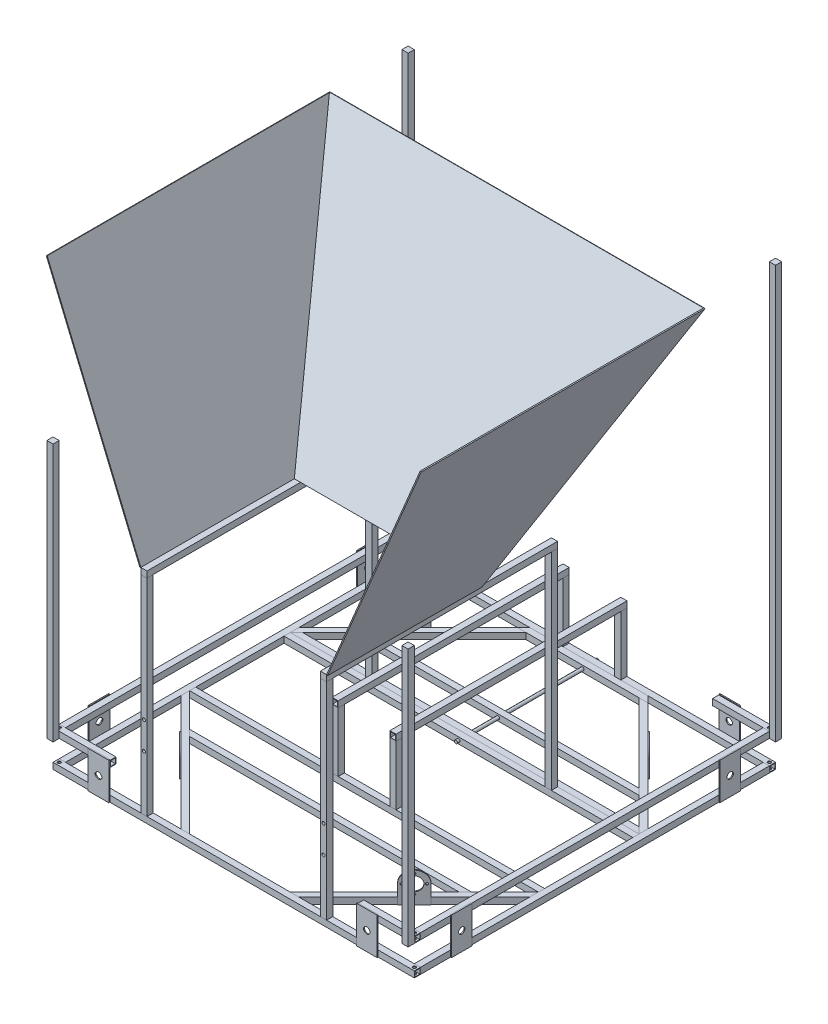
from build123d import *

# Parameters (mm, degrees)
BOSS_EXTRUDE1_DEPTH       = 12
BOSS_EXTRUDE1_2_DEPTH     = 12
SKETCH1_W                 = 676
SKETCH1_H                 = 12
BOSS_EXTRUDE1_3_DEPTH     = 12
BOSS_EXTRUDE1_4_DEPTH     = 12
BOSS_EXTRUDE1_5_DEPTH     = 12
BOSS_EXTRUDE1_6_DEPTH     = 12
SHELL1_T                  = -1.2
SHELL2_T                  = -1.2
SHELL3_T                  = -1.2
SHELL4_T                  = -1.2
SHELL5_T                  = -1.2
SHELL6_T                  = -1.2
BOSS_EXTRUDE2_DEPTH       = 12
BOSS_EXTRUDE2_2_DEPTH     = 12
BOSS_EXTRUDE2_3_DEPTH     = 12
BOSS_EXTRUDE2_4_DEPTH     = 12
SHELL7_T                  = -1.2
SHELL8_T                  = -1.2
SHELL9_T                  = -1.2
SHELL10_T                 = -1.2
BOSS_EXTRUDE3_DEPTH       = 12
BOSS_EXTRUDE3_2_DEPTH     = 12
BOSS_EXTRUDE3_3_DEPTH     = 12
BOSS_EXTRUDE3_4_DEPTH     = 12
SHELL11_T                 = -1.2
SHELL12_T                 = -1.2
SHELL13_T                 = -1.2
SHELL14_T                 = -1.2
BOSS_EXTRUDE4_START       = 5
SKETCH2_R                 = 3
BOSS_EXTRUDE4_DEPTH       = 274.422222789
LPATTERN1_COUNT           = 2
LPATTERN1_PITCH           = 58
SKETCH3_R                 = 2.1
SKETCH3_R_2               = 13.25
BOSS_EXTRUDE5_DEPTH       = 2
CIRPATTERN1_COUNT         = 4
SKETCH4_R                 = 3
CUT_EXTRUDE2_DEPTH        = 504.413349048
SKETCH8_W                 = 40
SKETCH8_H                 = 12
SKETCH8_H_2               = 59.4
BOSS_EXTRUDE6_DEPTH       = 2
CIRPATTERN2_START         = -352
CIRPATTERN2_OUTLINE_W     = 40
CIRPATTERN2_OUTLINE_H     = 71.4
CIRPATTERN2_DEPTH         = 2
CIRPATTERN2_2_OUTLINE_W   = 71.4
CIRPATTERN2_2_OUTLINE_H   = 40
CIRPATTERN2_2_DEPTH       = 2
CIRPATTERN2_START_2       = 350
CIRPATTERN2_3_OUTLINE_W   = 71.4
CIRPATTERN2_3_OUTLINE_H   = 40
CIRPATTERN2_3_DEPTH       = 2
SKETCH9_W                 = 480
SKETCH9_H                 = 25.007528644
CUT_EXTRUDE4_DEPTH        = 12
SKETCH13_W                = 12
SKETCH13_H                = 12
BOSS_EXTRUDE7_DEPTH       = 400
BOSS_EXTRUDE7_2_DEPTH     = 400
SKETCH16_W                = 12
SKETCH16_H                = 12
BOSS_EXTRUDE8_DEPTH       = 500
BOSS_EXTRUDE8_2_DEPTH     = 500
SKETCH17_W                = 12
SKETCH17_H                = 12
BOSS_EXTRUDE9_DEPTH       = 800
BOSS_EXTRUDE9_2_DEPTH     = 800
SKETCH18_W                = 12
SKETCH18_H                = 12
BOSS_EXTRUDE10_DEPTH      = 400
BOSS_EXTRUDE10_2_DEPTH    = 400
SKETCH19_W                = 12
SKETCH19_H                = 12
BOSS_EXTRUDE11_DEPTH      = 447.58
BOSS_EXTRUDE11_2_DEPTH    = 447.58
SKETCH20_R                = 3
CUT_EXTRUDE5_DEPTH        = 12
EXTRUDE_THIN1_OUTLINE_W   = 12
EXTRUDE_THIN1_OUTLINE_H   = 12
EXTRUDE_THIN1_OUTLINE_W_2 = 9.6
EXTRUDE_THIN1_OUTLINE_H_2 = 9.6
EXTRUDE_THIN1_DEPTH       = 115
SKETCH22_W                = 12
SKETCH22_H                = 12
SKETCH22_W_2              = 9.6
SKETCH22_H_2              = 9.6
EXTRUDE_THIN2_DEPTH       = 447.577777211
EXTRUDE_THIN2_2_DEPTH     = 447.577777211
SKETCH23_W                = 480
SKETCH23_H                = 12
CUT_EXTRUDE6_DEPTH        = 12
BOSS_EXTRUDE12_DEPTH      = 2
BOSS_EXTRUDE13_DEPTH      = 2


# Read off the part's stored shape, not the designer's step: CirPattern2, Extrude-Thin1
with BuildPart() as part:
    # Sketch1 → Boss-Extrude1 (new body)
    with BuildSketch(Plane(origin=(0, 0, 0), x_dir=(1, 0, 0), z_dir=(0, 1, 0))):
        Polygon((-350, -350), (350, -350), (350, -338), (338, -338), (114.548339959, -338), (97.577777211, -338), (-97.577777211, -338), (-114.548339959, -338), (-338, -338), (-350, -338), align=None)
    extrude(amount=BOSS_EXTRUDE1_DEPTH)

    # Shell1
    shell1_openings = [part.faces().sort_by_distance(p)[0] for p in [
        (-350, 6, 344),
        (350, 6, 344),
    ]]
    offset(amount=SHELL1_T, openings=shell1_openings, kind=Kind.INTERSECTION)


with BuildPart() as body_2:
    # Sketch1 → Boss-Extrude1 2 (new body)
    with BuildSketch(Plane(origin=(0, 0, 0), x_dir=(1, 0, 0), z_dir=(0, 1, 0))):
        Polygon((261.286323091, -174.29145412), (273.286323091, -162.29145412), (-273.286323091, -162.29145412), (-261.286323091, -174.29145412), align=None)
    extrude(amount=BOSS_EXTRUDE1_2_DEPTH)

    # Shell2
    shell2_openings = [body_2.faces().sort_by_distance(p)[0] for p in [
        (-267.286323091, 6, 168.29145412),
        (267.286323091, 6, 168.29145412),
    ]]
    offset(amount=SHELL2_T, openings=shell2_openings, kind=Kind.INTERSECTION)


with BuildPart() as body_3:
    # Sketch1 → Boss-Extrude1 3 (new body)
    with BuildSketch(Plane(origin=(0, 0, 0), x_dir=(1, 0, 0), z_dir=(0, 1, 0))):
        with Locations((0, -91.577777211)):
            Rectangle(SKETCH1_W, SKETCH1_H)
    extrude(amount=BOSS_EXTRUDE1_3_DEPTH)

    # Shell3
    shell3_openings = [body_3.faces().sort_by_distance(p)[0] for p in [
        (338, 6, 91.577777211),
        (-338, 6, 91.577777211),
    ]]
    offset(amount=SHELL3_T, openings=shell3_openings, kind=Kind.INTERSECTION)


with BuildPart() as body_4:
    # Sketch1 → Boss-Extrude1 4 (new body)
    with BuildSketch(Plane(origin=(0, 0, 0), x_dir=(1, 0, 0), z_dir=(0, 1, 0))):
        with Locations((0, 91.577777211)):
            Rectangle(SKETCH1_W, SKETCH1_H)
    extrude(amount=BOSS_EXTRUDE1_4_DEPTH)

    # Shell4
    shell4_openings = [body_4.faces().sort_by_distance(p)[0] for p in [
        (338, 6, -91.577777211),
        (-338, 6, -91.577777211),
    ]]
    offset(amount=SHELL4_T, openings=shell4_openings, kind=Kind.INTERSECTION)


with BuildPart() as body_5:
    # Sketch1 → Boss-Extrude1 5 (new body)
    with BuildSketch(Plane(origin=(0, 0, 0), x_dir=(1, 0, 0), z_dir=(0, 1, 0))):
        Polygon((338, 338), (350, 338), (350, 350), (-350, 350), (-350, 338), (-338, 338), (-114.548339959, 338), (114.548339959, 338), align=None)
    extrude(amount=BOSS_EXTRUDE1_5_DEPTH)

    # Shell6
    shell6_openings = [body_5.faces().sort_by_distance(p)[0] for p in [
        (-350, 6, -344),
        (350, 6, -344),
    ]]
    offset(amount=SHELL6_T, openings=shell6_openings, kind=Kind.INTERSECTION)


with BuildPart() as body_6:
    # Sketch1 → Boss-Extrude1 6 (new body)
    with BuildSketch(Plane(origin=(0, 0, 0), x_dir=(1, 0, 0), z_dir=(0, 1, 0))):
        Polygon((273.286323091, 162.29145412), (261.286323091, 174.29145412), (-261.286323091, 174.29145412), (-273.286323091, 162.29145412), align=None)
    extrude(amount=BOSS_EXTRUDE1_6_DEPTH)

    # Shell5
    shell5_openings = [body_6.faces().sort_by_distance(p)[0] for p in [
        (-267.286323091, 6, -168.29145412),
        (267.286323091, 6, -168.29145412),
    ]]
    offset(amount=SHELL5_T, openings=shell5_openings, kind=Kind.INTERSECTION)


with BuildPart() as body_7:
    # Sketch1<3> → Boss-Extrude2 (new body)
    with BuildSketch(Plane(origin=(0, 0, 0), x_dir=(1, 0, 0), z_dir=(0, 1, 0))):
        Polygon((-338, -97.577777211), (-338, -114.548339959), (-114.548339959, -338), (-97.577777211, -338), (-261.286323091, -174.29145412), (-273.286323091, -162.29145412), align=None)
    extrude(amount=BOSS_EXTRUDE2_DEPTH)

    # Shell7
    shell7_openings = [body_7.faces().sort_by_distance(p)[0] for p in [
        (-338, 6, 106.063058585),
        (-106.063058585, 6, 338),
    ]]
    offset(amount=SHELL7_T, openings=shell7_openings, kind=Kind.INTERSECTION)


with BuildPart() as body_8:
    # Sketch1<3> → Boss-Extrude2 2 (new body)
    with BuildSketch(Plane(origin=(0, 0, 0), x_dir=(1, 0, 0), z_dir=(0, 1, 0))):
        Polygon((114.548339959, -338), (338, -114.548339959), (338, -97.577777211), (273.286323091, -162.29145412), (261.286323091, -174.29145412), (97.577777211, -338), align=None)
    extrude(amount=BOSS_EXTRUDE2_2_DEPTH)

    # Shell8
    shell8_openings = [body_8.faces().sort_by_distance(p)[0] for p in [
        (106.063058585, 6, 338),
        (338, 6, 106.063058585),
    ]]
    offset(amount=SHELL8_T, openings=shell8_openings, kind=Kind.INTERSECTION)


with BuildPart() as body_9:
    # Sketch1<3> → Boss-Extrude2 3 (new body)
    with BuildSketch(Plane(origin=(0, 0, 0), x_dir=(1, 0, 0), z_dir=(0, 1, 0))):
        Polygon((-126.548339959, 326), (-338, 114.548339959), (-338, 97.577777211), (-326, 109.577777211), (-273.286323091, 162.29145412), (-261.286323091, 174.29145412), (-109.577777211, 326), align=None)
    extrude(amount=BOSS_EXTRUDE2_3_DEPTH)

    # Shell10
    shell10_openings = [body_9.faces().sort_by_distance(p)[0] for p in [
        (-338, 6, -106.063058585),
        (-118.063058585, 6, -326),
    ]]
    offset(amount=SHELL10_T, openings=shell10_openings, kind=Kind.INTERSECTION)


with BuildPart() as body_10:
    # Sketch1<3> → Boss-Extrude2 4 (new body)
    with BuildSketch(Plane(origin=(0, 0, 0), x_dir=(1, 0, 0), z_dir=(0, 1, 0))):
        Polygon((338, 97.577777211), (338, 114.548339959), (126.548339959, 326), (109.577777211, 326), (261.286323091, 174.29145412), (273.286323091, 162.29145412), (326, 109.577777211), align=None)
    extrude(amount=BOSS_EXTRUDE2_4_DEPTH)

    # Shell9
    shell9_openings = [body_10.faces().sort_by_distance(p)[0] for p in [
        (338, 6, -106.063058585),
        (118.063058585, 6, -326),
    ]]
    offset(amount=SHELL9_T, openings=shell9_openings, kind=Kind.INTERSECTION)


with BuildPart() as body_11:
    # Sketch1<4> → Boss-Extrude3 (new body)
    with BuildSketch(Plane(origin=(0, 0, 0), x_dir=(1, 0, 0), z_dir=(0, 1, 0))):
        Polygon((-350, 338), (-350, -338), (-338, -338), (-338, -114.548339959), (-338, -97.577777211), (-338, -85.577777211), (-338, 85.577777211), (-338, 97.577777211), (-338, 114.548339959), (-338, 338), align=None)
    extrude(amount=BOSS_EXTRUDE3_DEPTH)

    # Shell14
    shell14_openings = [body_11.faces().sort_by_distance(p)[0] for p in [
        (-344, 6, -338),
        (-344, 6, 338),
    ]]
    offset(amount=SHELL14_T, openings=shell14_openings, kind=Kind.INTERSECTION)


with BuildPart() as body_12:
    # Sketch1<4> → Boss-Extrude3 2 (new body)
    with BuildSketch(Plane(origin=(0, 0, 0), x_dir=(1, 0, 0), z_dir=(0, 1, 0))):
        Polygon((126.548339959, 326), (114.548339959, 338), (-114.548339959, 338), (-126.548339959, 326), (-109.577777211, 326), (109.577777211, 326), align=None)
    extrude(amount=BOSS_EXTRUDE3_2_DEPTH)

    # Shell12
    shell12_openings = [body_12.faces().sort_by_distance(p)[0] for p in [
        (-120.548339959, 6, -332),
        (120.548339959, 6, -332),
    ]]
    offset(amount=SHELL12_T, openings=shell12_openings, kind=Kind.INTERSECTION)


with BuildPart() as body_13:
    # Sketch1<4> → Boss-Extrude3 3 (new body)
    with BuildSketch(Plane(origin=(0, 0, 0), x_dir=(1, 0, 0), z_dir=(0, 1, 0))):
        Polygon((338, -338), (350, -338), (350, 338), (338, 338), (338, 114.548339959), (338, 97.577777211), (338, 85.577777211), (338, -85.577777211), (338, -97.577777211), (338, -114.548339959), align=None)
    extrude(amount=BOSS_EXTRUDE3_3_DEPTH)

    # Shell13
    shell13_openings = [body_13.faces().sort_by_distance(p)[0] for p in [
        (344, 6, -338),
        (344, 6, 338),
    ]]
    offset(amount=SHELL13_T, openings=shell13_openings, kind=Kind.INTERSECTION)


with BuildPart() as body_14:
    # Sketch1<4> → Boss-Extrude3 4 (new body)
    with BuildSketch(Plane(origin=(0, 0, 0), x_dir=(1, 0, 0), z_dir=(0, 1, 0))):
        Polygon((-338, 97.577777211), (338, 97.577777211), (326, 109.577777211), (-326, 109.577777211), align=None)
    extrude(amount=BOSS_EXTRUDE3_4_DEPTH)

    # Shell11
    shell11_openings = [body_14.faces().sort_by_distance(p)[0] for p in [
        (332, 6, -103.577777211),
        (-332, 6, -103.577777211),
    ]]
    offset(amount=SHELL11_T, openings=shell11_openings, kind=Kind.INTERSECTION)


with BuildPart() as body_15:
    # Sketch2 → Boss-Extrude4 (new body)
    with BuildSketch(Plane(origin=(0, 0, -350), x_dir=(-1, 0, 0), z_dir=(0, 0, -1)).offset(BOSS_EXTRUDE4_START)):
        with Locations((0, 6)):
            Circle(SKETCH2_R)
    extrude(amount=-BOSS_EXTRUDE4_DEPTH)


with BuildPart() as lpattern1_1:
    # LPattern1: pattern copy
    add(body_11.part.moved(Location(Vector(0, 1, 0) * (1 * LPATTERN1_PITCH))))


with BuildPart() as lpattern1_2:
    # LPattern1: pattern copy
    add(body_5.part.moved(Location(Vector(0, 1, 0) * (1 * LPATTERN1_PITCH))))


with BuildPart() as lpattern1_3:
    # LPattern1: pattern copy
    add(body_13.part.moved(Location(Vector(0, 1, 0) * (1 * LPATTERN1_PITCH))))


with BuildPart() as lpattern1_4:
    # LPattern1: pattern copy
    add(part.part.moved(Location(Vector(0, 1, 0) * (1 * LPATTERN1_PITCH))))


with BuildPart() as body_20:
    # Sketch3 → Boss-Extrude5 (new body)
    with BuildSketch(Plane(origin=(226.27416998, 0, -226.27416998), x_dir=(-0.7071067811865475, 0, -0.7071067811865477), z_dir=(0.7071067811865477, 0, -0.7071067811865475))):
        with BuildLine():
            Line((-23, 35.7), (-23, 0))
            Line((-23, 0), (23, 0))
            Line((23, 0), (23, 35.7))
            ThreePointArc((23, 35.7), (0, 58.7), (-23, 35.7))
        make_face()
        with Locations((17.5, 35.7)):
            Circle(SKETCH3_R, mode=Mode.SUBTRACT)
        with Locations((0, 18.2)):
            Circle(SKETCH3_R, mode=Mode.SUBTRACT)
        with Locations((0, 35.7)):
            Circle(SKETCH3_R_2, mode=Mode.SUBTRACT)
        with Locations((-17.5, 35.7)):
            Circle(SKETCH3_R, mode=Mode.SUBTRACT)
        with Locations((0, 53.2)):
            Circle(SKETCH3_R, mode=Mode.SUBTRACT)
    extrude(amount=BOSS_EXTRUDE5_DEPTH)


with BuildPart() as cirpattern1_1:
    # CirPattern1: pattern copy
    add(body_20.part.rotate(Axis((0, 0, 0), (0, 1, 0)), 1 * 360 / CIRPATTERN1_COUNT))


with BuildPart() as cirpattern1_2:
    # CirPattern1: pattern copy
    add(body_20.part.rotate(Axis((0, 0, 0), (0, 1, 0)), 2 * 360 / CIRPATTERN1_COUNT))


with BuildPart() as cirpattern1_3:
    # CirPattern1: pattern copy
    add(body_20.part.rotate(Axis((0, 0, 0), (0, 1, 0)), 3 * 360 / CIRPATTERN1_COUNT))


with BuildPart() as cut_extrude2_tool:
    # Sketch4 → Cut-Extrude2 (new, through all)
    with BuildSketch(Plane(origin=(0, 0, 0), x_dir=(1, 0, 0), z_dir=(0, 1, 0))):
        with Locations(Location((-344, 344, 0), (0, 0, 270))):
            Circle(SKETCH4_R)
        with Locations(Location((344, 344, 0), (0, 0, 270))):
            Circle(SKETCH4_R)
        with Locations(Location((344, -344, 0), (0, 0, 270))):
            Circle(SKETCH4_R)
        with Locations(Location((-344, -344, 0), (0, 0, 270))):
            Circle(SKETCH4_R)
    extrude(amount=CUT_EXTRUDE2_DEPTH)


with BuildPart() as part_1:
    add(part.part)

    # Cut-Extrude2: cut by cut_extrude2_tool
    add(cut_extrude2_tool.part, mode=Mode.SUBTRACT)


with BuildPart() as body_5_1:
    add(body_5.part)

    # Cut-Extrude2: cut by cut_extrude2_tool
    add(cut_extrude2_tool.part, mode=Mode.SUBTRACT)



with BuildPart() as lpattern1_2_1:
    add(lpattern1_2.part)

    # Cut-Extrude2: cut by cut_extrude2_tool
    add(cut_extrude2_tool.part, mode=Mode.SUBTRACT)


with BuildPart() as lpattern1_4_1:
    add(lpattern1_4.part)

    # Cut-Extrude2: cut by cut_extrude2_tool
    add(cut_extrude2_tool.part, mode=Mode.SUBTRACT)

    # Sketch9 → Cut-Extrude4 (cut)
    with BuildSketch(Plane.XY.offset(350)):
        with Locations((0, 57.496235678)):
            Rectangle(SKETCH9_W, SKETCH9_H)
    extrude(amount=-CUT_EXTRUDE4_DEPTH, mode=Mode.SUBTRACT)


with BuildPart() as body_24:
    # Sketch8 → Boss-Extrude6 (new body)
    # profile 1 of 4: a face of its own
    with BuildSketch(Plane.XY.offset(350)):
        with Locations((-260, 6)):
            Rectangle(SKETCH8_W, SKETCH8_H)
    # profile 2 of 4: a face of its own
    with BuildSketch(Plane.XY.offset(350)):
        with Locations((-260, 41.7)):
            Rectangle(SKETCH8_W, SKETCH8_H_2)
        with BuildLine():
            Line((-253.5, 33.7), (-254.343145751, 33.7))
            ThreePointArc((-254.343145751, 33.7), (-260, 29.7), (-265.656854249, 33.7))
            Line((-265.656854249, 33.7), (-266.5, 33.7))
            Line((-266.5, 33.7), (-266.5, 37.7))
            Line((-266.5, 37.7), (-265.656854249, 37.7))
            ThreePointArc((-265.656854249, 37.7), (-260, 41.7), (-254.343145751, 37.7))
            Line((-254.343145751, 37.7), (-253.5, 37.7))
            Line((-253.5, 37.7), (-253.5, 33.7))
        make_face(mode=Mode.SUBTRACT)
    # profile 3 of 4: a face of its own
    with BuildSketch(Plane.XY.offset(350)):
        with Locations((260, 6)):
            Rectangle(SKETCH8_W, SKETCH8_H)
    # profile 4 of 4: a face of its own
    with BuildSketch(Plane.XY.offset(350)):
        with Locations((260, 41.7)):
            Rectangle(SKETCH8_W, SKETCH8_H_2)
        with BuildLine():
            Line((265.656854249, 37.7), (266.5, 37.7))
            Line((266.5, 37.7), (266.5, 33.7))
            Line((266.5, 33.7), (265.656854249, 33.7))
            ThreePointArc((265.656854249, 33.7), (260, 29.7), (254.343145751, 33.7))
            Line((254.343145751, 33.7), (253.5, 33.7))
            Line((253.5, 33.7), (253.5, 37.7))
            Line((253.5, 37.7), (254.343145751, 37.7))
            ThreePointArc((254.343145751, 37.7), (260, 41.7), (265.656854249, 37.7))
        make_face(mode=Mode.SUBTRACT)
    extrude(amount=BOSS_EXTRUDE6_DEPTH)


with BuildPart() as body_5_2:
    add(body_5_1.part)

    add(lpattern1_2_1.part)  # CirPattern2 merges LPattern1_2
    # CirPattern2 outline → CirPattern2 (add)
    # profile 1 of 2: a face of its own
    with BuildSketch(Plane.XY.offset(CIRPATTERN2_START)):
        with Locations((-260, 35.7)):
            Rectangle(CIRPATTERN2_OUTLINE_W, CIRPATTERN2_OUTLINE_H)
        with BuildLine():
            Line((-266.5, 33.7), (-266.5, 37.7))
            Line((-266.5, 37.7), (-265.656854249, 37.7))
            ThreePointArc((-265.656854249, 37.7), (-260, 41.7), (-254.343145751, 37.7))
            Line((-254.343145751, 37.7), (-253.5, 37.7))
            Line((-253.5, 37.7), (-253.5, 33.7))
            Line((-253.5, 33.7), (-254.343145751, 33.7))
            ThreePointArc((-254.343145751, 33.7), (-260, 29.7), (-265.656854249, 33.7))
            Line((-265.656854249, 33.7), (-266.5, 33.7))
        make_face(mode=Mode.SUBTRACT)
    # profile 2 of 2: a face of its own
    with BuildSketch(Plane.XY.offset(CIRPATTERN2_START)):
        with Locations((260, 35.7)):
            Rectangle(CIRPATTERN2_OUTLINE_W, CIRPATTERN2_OUTLINE_H)
        with BuildLine():
            ThreePointArc((265.656854249, 33.7), (260, 29.7), (254.343145751, 33.7))
            Line((254.343145751, 33.7), (253.5, 33.7))
            Line((253.5, 33.7), (253.5, 37.7))
            Line((253.5, 37.7), (254.343145751, 37.7))
            ThreePointArc((254.343145751, 37.7), (260, 41.7), (265.656854249, 37.7))
            Line((265.656854249, 37.7), (266.5, 37.7))
            Line((266.5, 37.7), (266.5, 33.7))
            Line((266.5, 33.7), (265.656854249, 33.7))
        make_face(mode=Mode.SUBTRACT)
    extrude(amount=CIRPATTERN2_DEPTH)

    # Sketch23 → Cut-Extrude6 (cut)
    with BuildSketch(Plane(origin=(0, 70, 0), x_dir=(1, 0, 0), z_dir=(0, 1, 0))):
        with Locations((0, 344)):
            Rectangle(SKETCH23_W, SKETCH23_H)
    extrude(amount=-CUT_EXTRUDE6_DEPTH, mode=Mode.SUBTRACT)


with BuildPart() as body_11_1:
    add(body_11.part)

    add(lpattern1_1.part)  # CirPattern2 2 merges LPattern1_1
    # CirPattern2 2 outline → CirPattern2 2 (add)
    # profile 1 of 2: a face of its own
    with BuildSketch(Plane.YZ.offset(CIRPATTERN2_START)):
        with Locations((35.7, -260)):
            Rectangle(CIRPATTERN2_2_OUTLINE_W, CIRPATTERN2_2_OUTLINE_H)
        with BuildLine():
            ThreePointArc((37.7, -254.343145751), (41.7, -260), (37.7, -265.656854249))
            Line((37.7, -265.656854249), (37.7, -266.5))
            Line((37.7, -266.5), (33.7, -266.5))
            Line((33.7, -266.5), (33.7, -265.656854249))
            ThreePointArc((33.7, -265.656854249), (29.7, -260), (33.7, -254.343145751))
            Line((33.7, -254.343145751), (33.7, -253.5))
            Line((33.7, -253.5), (37.7, -253.5))
            Line((37.7, -253.5), (37.7, -254.343145751))
        make_face(mode=Mode.SUBTRACT)
    # profile 2 of 2: a face of its own
    with BuildSketch(Plane.YZ.offset(CIRPATTERN2_START)):
        with Locations((35.7, 260)):
            Rectangle(CIRPATTERN2_2_OUTLINE_W, CIRPATTERN2_2_OUTLINE_H)
        with BuildLine():
            Line((37.7, 266.5), (37.7, 265.656854249))
            ThreePointArc((37.7, 265.656854249), (41.7, 260), (37.7, 254.343145751))
            Line((37.7, 254.343145751), (37.7, 253.5))
            Line((37.7, 253.5), (33.7, 253.5))
            Line((33.7, 253.5), (33.7, 254.343145751))
            ThreePointArc((33.7, 254.343145751), (29.7, 260), (33.7, 265.656854249))
            Line((33.7, 265.656854249), (33.7, 266.5))
            Line((33.7, 266.5), (37.7, 266.5))
        make_face(mode=Mode.SUBTRACT)
    extrude(amount=CIRPATTERN2_2_DEPTH)


with BuildPart() as body_13_1:
    add(body_13.part)

    add(lpattern1_3.part)  # CirPattern2 3 merges LPattern1_3
    # CirPattern2 3 outline → CirPattern2 3 (add)
    # profile 1 of 2: a face of its own
    with BuildSketch(Plane.YZ.offset(CIRPATTERN2_START_2)):
        with Locations((35.7, -260)):
            Rectangle(CIRPATTERN2_3_OUTLINE_W, CIRPATTERN2_3_OUTLINE_H)
        with BuildLine():
            ThreePointArc((37.7, -254.343145751), (41.7, -260), (37.7, -265.656854249))
            Line((37.7, -265.656854249), (37.7, -266.5))
            Line((37.7, -266.5), (33.7, -266.5))
            Line((33.7, -266.5), (33.7, -265.656854249))
            ThreePointArc((33.7, -265.656854249), (29.7, -260), (33.7, -254.343145751))
            Line((33.7, -254.343145751), (33.7, -253.5))
            Line((33.7, -253.5), (37.7, -253.5))
            Line((37.7, -253.5), (37.7, -254.343145751))
        make_face(mode=Mode.SUBTRACT)
    # profile 2 of 2: a face of its own
    with BuildSketch(Plane.YZ.offset(CIRPATTERN2_START_2)):
        with Locations((35.7, 260)):
            Rectangle(CIRPATTERN2_3_OUTLINE_W, CIRPATTERN2_3_OUTLINE_H)
        with BuildLine():
            Line((37.7, 266.5), (37.7, 265.656854249))
            ThreePointArc((37.7, 265.656854249), (41.7, 260), (37.7, 254.343145751))
            Line((37.7, 254.343145751), (37.7, 253.5))
            Line((37.7, 253.5), (33.7, 253.5))
            Line((33.7, 253.5), (33.7, 254.343145751))
            ThreePointArc((33.7, 254.343145751), (29.7, 260), (33.7, 265.656854249))
            Line((33.7, 265.656854249), (33.7, 266.5))
            Line((33.7, 266.5), (37.7, 266.5))
        make_face(mode=Mode.SUBTRACT)
    extrude(amount=CIRPATTERN2_3_DEPTH)


with BuildPart() as cut_extrude4_piece_1:
    # of the separate pieces the step leaves, piece 1, a body of its own (cut_extrude4_pieces)
    add(lpattern1_4_1.part.solids().sort_by_distance((-350, 58, 350))[0])


with BuildPart() as cut_extrude4_piece_2:
    # of the separate pieces the step leaves, piece 2, a body of its own (cut_extrude4_pieces)
    add(lpattern1_4_1.part.solids().sort_by_distance((240, 58, 350))[0])


with BuildPart() as body_23:
    # Sketch13 → Boss-Extrude7 (new body)
    with BuildSketch(Plane(origin=(0, 12, 0), x_dir=(1, 0, 0), z_dir=(0, 1, 0))):
        with Locations((-174, -344)):
            Rectangle(SKETCH13_W, SKETCH13_H)
    extrude(amount=BOSS_EXTRUDE7_DEPTH)


with BuildPart() as body_24_2:
    # Sketch13 → Boss-Extrude7 2 (new body)
    with BuildSketch(Plane(origin=(0, 12, 0), x_dir=(1, 0, 0), z_dir=(0, 1, 0))):
        with Locations((174, -344)):
            Rectangle(SKETCH13_W, SKETCH13_H)
    extrude(amount=BOSS_EXTRUDE7_2_DEPTH)


with BuildPart() as body_25:
    # Sketch16 → Boss-Extrude8 (new body)
    with BuildSketch(Plane.XZ.offset(-58)):
        with Locations((-344, 356)):
            Rectangle(SKETCH16_W, SKETCH16_H)
    extrude(amount=-BOSS_EXTRUDE8_DEPTH)


with BuildPart() as body_26:
    # Sketch16 → Boss-Extrude8 2 (new body)
    with BuildSketch(Plane.XZ.offset(-58)):
        with Locations((344, 356)):
            Rectangle(SKETCH16_W, SKETCH16_H)
    extrude(amount=-BOSS_EXTRUDE8_2_DEPTH)


with BuildPart() as body_27:
    # Sketch17 → Boss-Extrude9 (new body)
    with BuildSketch(Plane.XZ.offset(-58)):
        with Locations((356, -344)):
            Rectangle(SKETCH17_W, SKETCH17_H)
    extrude(amount=-BOSS_EXTRUDE9_DEPTH)


with BuildPart() as body_28:
    # Sketch17 → Boss-Extrude9 2 (new body)
    with BuildSketch(Plane.XZ.offset(-58)):
        with Locations((-356, -344)):
            Rectangle(SKETCH17_W, SKETCH17_H)
    extrude(amount=-BOSS_EXTRUDE9_2_DEPTH)


with BuildPart() as body_29:
    # Sketch18 → Boss-Extrude10 (new body)
    with BuildSketch(Plane(origin=(0, 12, 0), x_dir=(1, 0, 0), z_dir=(0, 1, 0))):
        with Locations((-174, 91.577777211)):
            Rectangle(SKETCH18_W, SKETCH18_H)
    extrude(amount=BOSS_EXTRUDE10_DEPTH)


with BuildPart() as body_30:
    # Sketch18 → Boss-Extrude10 2 (new body)
    with BuildSketch(Plane(origin=(0, 12, 0), x_dir=(1, 0, 0), z_dir=(0, 1, 0))):
        with Locations((174, 91.577777211)):
            Rectangle(SKETCH18_W, SKETCH18_H)
    extrude(amount=BOSS_EXTRUDE10_2_DEPTH)


with BuildPart() as body_31:
    # Sketch19 → Boss-Extrude11 (new body)
    with BuildSketch(Plane.XY.offset(350)):
        with Locations((-174, 418)):
            Rectangle(SKETCH19_W, SKETCH19_H)
    extrude(amount=-BOSS_EXTRUDE11_DEPTH)


with BuildPart() as body_32:
    # Sketch19 → Boss-Extrude11 2 (new body)
    with BuildSketch(Plane.XY.offset(350)):
        with Locations((174, 418)):
            Rectangle(SKETCH19_W, SKETCH19_H)
    extrude(amount=-BOSS_EXTRUDE11_2_DEPTH)


with BuildPart() as cut_extrude5_tool:
    # Sketch20 → Cut-Extrude5 (new body)
    with BuildSketch(Plane.XY.offset(350)):
        with Locations((-174, 171.5478326)):
            Circle(SKETCH20_R)
        with Locations((-174, 118.5478326)):
            Circle(SKETCH20_R)
        with Locations(Location((174, 171.5478326, 0), (0, 0, 180))):
            Circle(SKETCH20_R)
        with Locations(Location((174, 118.5478326, 0), (0, 0, 180))):
            Circle(SKETCH20_R)
    extrude(amount=-CUT_EXTRUDE5_DEPTH)


with BuildPart() as body_23_1:
    add(body_23.part)

    # Cut-Extrude5: cut by cut_extrude5_tool
    add(cut_extrude5_tool.part, mode=Mode.SUBTRACT)


with BuildPart() as body_24_2_1:
    add(body_24_2.part)

    # Cut-Extrude5: cut by cut_extrude5_tool
    add(cut_extrude5_tool.part, mode=Mode.SUBTRACT)


with BuildPart() as body_33:
    # Extrude-Thin1 outline → Extrude-Thin1 (new body)
    # profile 1 of 4: a face of its own
    with BuildSketch(Plane(origin=(0, 12, 0), x_dir=(1, 0, 0), z_dir=(0, 1, 0))):
        with Locations((56.11503986, 344)):
            Rectangle(EXTRUDE_THIN1_OUTLINE_W, EXTRUDE_THIN1_OUTLINE_H)
        with Locations((56.11503986, 344)):
            Rectangle(EXTRUDE_THIN1_OUTLINE_W_2, EXTRUDE_THIN1_OUTLINE_H_2, mode=Mode.SUBTRACT)
    # profile 2 of 4: a face of its own
    with BuildSketch(Plane(origin=(0, 12, 0), x_dir=(1, 0, 0), z_dir=(0, 1, 0))):
        with Locations((56.11503986, -91.577777211)):
            Rectangle(EXTRUDE_THIN1_OUTLINE_W, EXTRUDE_THIN1_OUTLINE_H)
        with Locations((56.11503986, -91.577777211)):
            Rectangle(EXTRUDE_THIN1_OUTLINE_W_2, EXTRUDE_THIN1_OUTLINE_H_2, mode=Mode.SUBTRACT)
    # profile 3 of 4: a face of its own
    with BuildSketch(Plane(origin=(0, 12, 0), x_dir=(1, 0, 0), z_dir=(0, 1, 0))):
        with Locations((-55.88496014, 344)):
            Rectangle(EXTRUDE_THIN1_OUTLINE_W, EXTRUDE_THIN1_OUTLINE_H)
        with Locations((-55.88496014, 344)):
            Rectangle(EXTRUDE_THIN1_OUTLINE_W_2, EXTRUDE_THIN1_OUTLINE_H_2, mode=Mode.SUBTRACT)
    # profile 4 of 4: a face of its own
    with BuildSketch(Plane(origin=(0, 12, 0), x_dir=(1, 0, 0), z_dir=(0, 1, 0))):
        with Locations((-55.88496014, -91.577777211)):
            Rectangle(EXTRUDE_THIN1_OUTLINE_W, EXTRUDE_THIN1_OUTLINE_H)
        with Locations((-55.88496014, -91.577777211)):
            Rectangle(EXTRUDE_THIN1_OUTLINE_W_2, EXTRUDE_THIN1_OUTLINE_H_2, mode=Mode.SUBTRACT)
    extrude(amount=EXTRUDE_THIN1_DEPTH)


with BuildPart() as body_34:
    # Sketch22 → Extrude-Thin2 (new body)
    with BuildSketch(Plane.XY.offset(97.577777211)):
        with Locations((-55.88496014, 133)):
            Rectangle(SKETCH22_W, SKETCH22_H)
        with Locations((-55.88496014, 133)):
            Rectangle(SKETCH22_W_2, SKETCH22_H_2, mode=Mode.SUBTRACT)
    extrude(amount=-EXTRUDE_THIN2_DEPTH)


with BuildPart() as body_35:
    # Sketch22 → Extrude-Thin2 2 (new body)
    with BuildSketch(Plane.XY.offset(97.577777211)):
        with Locations((56.11503986, 133)):
            Rectangle(SKETCH22_W, SKETCH22_H)
        with Locations((56.11503986, 133)):
            Rectangle(SKETCH22_W_2, SKETCH22_H_2, mode=Mode.SUBTRACT)
    extrude(amount=-EXTRUDE_THIN2_2_DEPTH)


with BuildPart() as body_36:
    # Sketch25 → Boss-Extrude12 (new body)
    with BuildSketch(Plane(origin=(0, 128.698525833, 222.912385602), x_dir=(0, 0.8660254037844363, -0.5000000000000041), z_dir=(0, -0.5000000000000041, -0.8660254037844363))):
        Polygon((340.984771205, 180), (340.984771205, -180), (840.984771205, -361.985117133), (840.984771205, 361.985117133), align=None)
    extrude(amount=BOSS_EXTRUDE12_DEPTH)


with BuildPart() as body_37:
    # Sketch27 → Boss-Extrude13 (new body)
    with BuildSketch(Plane(origin=(-2.241822003, -0.940371481, 0.003141776), x_dir=(-0.0011917462589495548, -0.0004998988291498091, -0.9999991649206589), z_dir=(0.92215655451894, 0.38681470861353273, -0.0012923459231589693))):
        Polygon((199.315359028, 929.39966753), (-50.684849742, 459.699253997), (-349.997150499, 460.621411322), (-349.997150499, 929.39966753), align=None)
    extrude(amount=-BOSS_EXTRUDE13_DEPTH)


with BuildPart() as body_38:
    # Mirror2: mirrored copy
    add(body_37.part.mirror(Plane(origin=(0, 0, 0), x_dir=(0, 0, 1), z_dir=(1, 0, 0))))


solid = Compound([body_2.part, body_3.part, body_4.part, body_6.part, body_7.part, body_8.part, body_9.part, body_10.part, body_12.part, body_14.part, body_15.part, body_20.part, cirpattern1_1.part, cirpattern1_2.part, cirpattern1_3.part, part_1.part, body_24.part, body_5_2.part, body_11_1.part, body_13_1.part, cut_extrude4_piece_1.part, cut_extrude4_piece_2.part, body_25.part, body_26.part, body_27.part, body_28.part, body_29.part, body_30.part, body_31.part, body_32.part, body_23_1.part, body_24_2_1.part, body_33.part, body_34.part, body_35.part, body_36.part, body_37.part, body_38.part])
